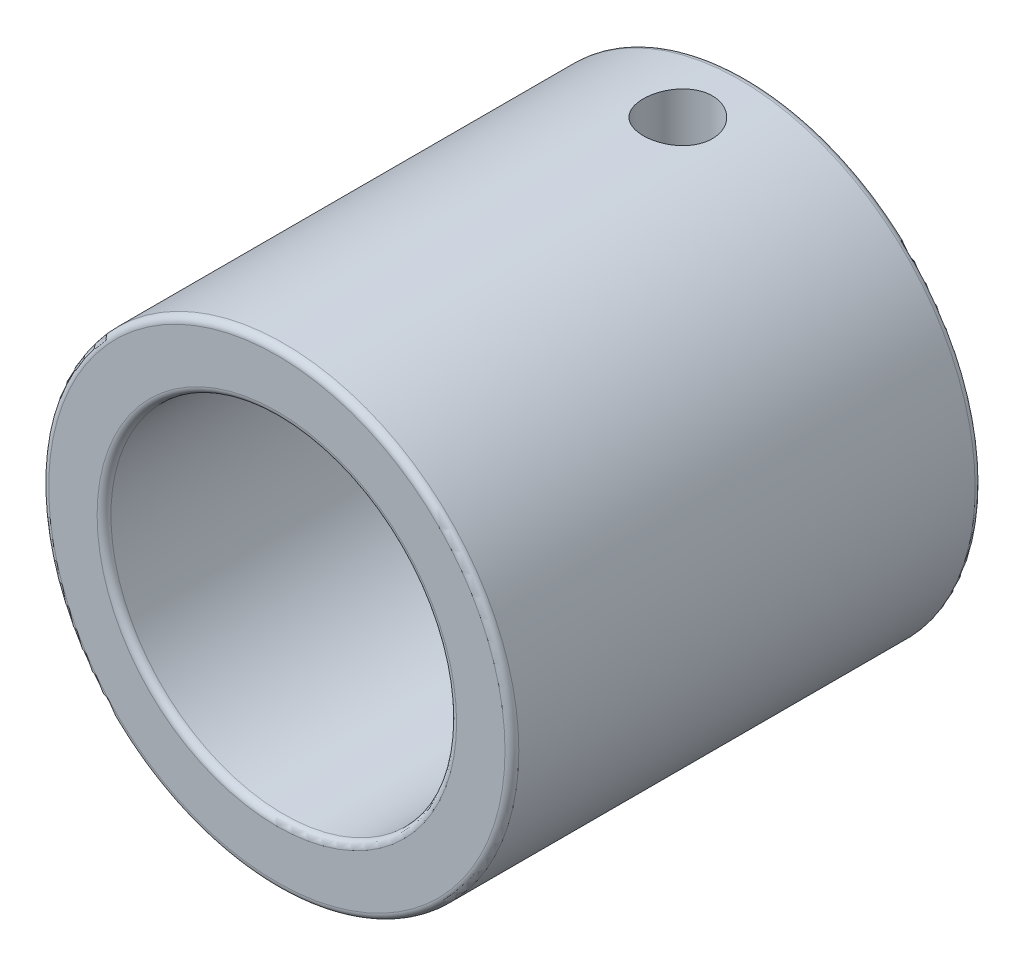
from build123d import *

# Parameters (mm, degrees)
IZIM1_R                     = 17
IZIM1_R_2                   = 12.5
Y_KSEKLIK_EKSTR_ZYON1_DEPTH = 34
RADYUS1_R                   = 0.5
KES_EKSTR_ZYON1_DEPTH       = 42.641325709
KES_EKSTR_ZYON1_DEPTH_BACK  = 42.641325709
IZIM2_R                     = 2.5


with BuildPart() as part:
    # Çizim1 → Yükseklik-Ekstrüzyon1 (new body)
    with BuildSketch(Plane.XY):
        Circle(IZIM1_R)
        Circle(IZIM1_R_2, mode=Mode.SUBTRACT)
    extrude(amount=Y_KSEKLIK_EKSTR_ZYON1_DEPTH)

    # Radyus1
    radyus1_edges = [part.edges().sort_by_distance(p)[0] for p in [
        (-12.5, 0, 0),
        (-17, 0, 0),
        (-12.5, 0, 34),
        (-17, 0, 34),
    ]]
    fillet(radyus1_edges, radius=RADYUS1_R)

    # Çizim2 → Kes-Ekstrüzyon1 (cut, two sides: drawn at the far end of the back side and taken through both)
    with BuildSketch(Plane(origin=(0, 0, 0), x_dir=(1, 0, 0), z_dir=(0, 1, 0)).offset(-KES_EKSTR_ZYON1_DEPTH_BACK)):
        with Locations((0, -5)):
            Circle(IZIM2_R)
    extrude(amount=KES_EKSTR_ZYON1_DEPTH + KES_EKSTR_ZYON1_DEPTH_BACK, mode=Mode.SUBTRACT)


solid = part.part
